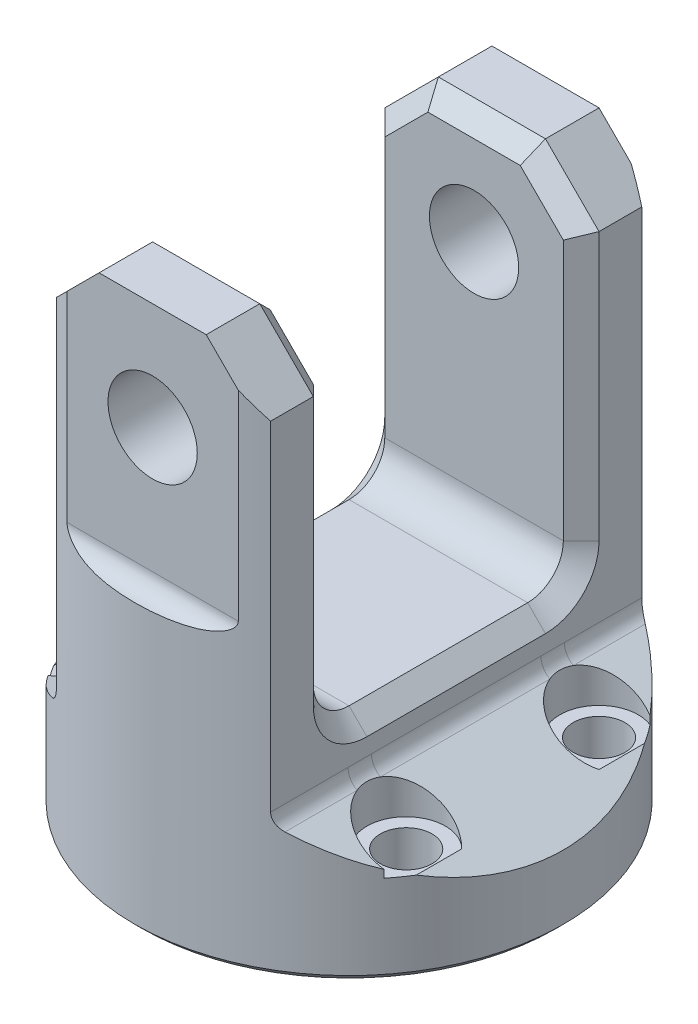
from build123d import *

# Parameters (mm, degrees)
SKETCH_1_R                    = 60
EXTRUDE_1_DEPTH               = 150
SKETCH_2_OUTSIDE_W            = 167.3
SKETCH_2_OUTSIDE_H            = 197.3
CUT_EXTRUDE_2_DEPTH           = 75
SKETCH_3_W                    = 5
SKETCH_3_H                    = 70
CUT_EXTRUDE_3_DEPTH           = 185.932420089
SKETCH_4_W                    = 70
SKETCH_4_H                    = 100
CUT_EXTRUDE_4_DEPTH           = 185.932420089
M27X2_0_1_D                   = 25
HOLE_WIZARD_M16_2_D           = 14.5
HOLE_WIZARD_M16_2_CBORE_D     = 22
HOLE_WIZARD_M16_2_CBORE_DEPTH = 12
CHAMFER_1_SIZE                = 15
FILLET_1_R                    = 10
CHAMFER_2_SIZE                = 5
FILLET_2_R                    = 5
FILLET_3_R                    = 5
CHAMFER_3_SIZE                = 2


# Some blends are built 0.0001 mm under size
with BuildPart() as part:
    # 草圖1 → 填料-伸長1 (new body)
    with BuildSketch(Plane(origin=(0, 0, 0), x_dir=(1, 0, 0), z_dir=(0, 1, 0))):
        with Locations(Location((0, 0, 0), (0, 0, 270))):
            Circle(SKETCH_1_R)
    extrude(amount=EXTRUDE_1_DEPTH)

    # 草圖2 outside → 除料-伸長2 (cut, symmetric)
    with BuildSketch(Plane.XY):
        with Locations((0, 75)):
            Rectangle(SKETCH_2_OUTSIDE_W, SKETCH_2_OUTSIDE_H)
        Polygon((-30, 150), (30, 150), (30, 37.320508076), (60, 20), (60, 0), (-60, 0), (-60, 20), (-30, 37.320508076), align=None, mode=Mode.SUBTRACT)
    extrude(amount=CUT_EXTRUDE_2_DEPTH, both=True, mode=Mode.SUBTRACT)

    # 草圖3 → 除料-伸長3 (cut, through all)
    with BuildSketch(Plane.ZY.offset(30)):
        with Locations((57.5, 115)):
            Rectangle(SKETCH_3_W, SKETCH_3_H)
        with Locations((-57.5, 115)):
            Rectangle(SKETCH_3_W, SKETCH_3_H)
    extrude(amount=-CUT_EXTRUDE_3_DEPTH, mode=Mode.SUBTRACT)

    # 草圖4 → 除料-伸長4 (cut, through all)
    with BuildSketch(Plane(origin=(30, 0, 0), x_dir=(0, 0, -1), z_dir=(1, 0, 0))):
        with Locations((0, 100)):
            Rectangle(SKETCH_4_W, SKETCH_4_H)
    extrude(amount=-CUT_EXTRUDE_4_DEPTH, mode=Mode.SUBTRACT)

    # M27x2.0 螺紋孔1 (through all)
    with Locations(Plane.XY.offset(55)):
        with Locations((0, 120)):
            Hole(M27X2_0_1_D / 2)

    # M16 六角頭螺栓的柱孔2 (through all)
    with Locations(Plane(origin=(0, 37.320508076, 0), x_dir=(1, 0, 0), z_dir=(0, 1, 0))):
        with Locations((43, -27), (43, 27), (-43, 27), (-43, -27)):
            CounterBoreHole(HOLE_WIZARD_M16_2_D / 2, HOLE_WIZARD_M16_2_CBORE_D / 2, HOLE_WIZARD_M16_2_CBORE_DEPTH)

    # 導角1
    # the kernel refuses this chamfer: 15 mm, written as the material it takes off along each edge
    with BuildSketch(Plane(origin=(30, 150, -3.575244819), x_dir=(0.0274958766105861, -0.9996219169112968, 0), z_dir=(0, 0, 1)), Plane(origin=(-30, 150, 90.536769047), x_dir=(-0.0274958766105861, -0.9996219169112968, 0), z_dir=(0, 0, -1)), Plane(origin=(30, 150, -90.536769047), x_dir=(0.0274958766105861, -0.9996219169112968, 0), z_dir=(0, 0, 1))) as chamfer_1_piece_1:
        Polygon((CHAMFER_1_SIZE * 0.999621916911, -CHAMFER_1_SIZE * 0.0274958766106), (-CHAMFER_1_SIZE * 0.0274958766106, -CHAMFER_1_SIZE * 0.999621916911), (0, 0), align=None)
    extrude(amount=94.112013866, mode=Mode.SUBTRACT)
    with BuildSketch(Plane(origin=(-30, 150, 3.575244819), x_dir=(0.9996219169112968, 0.02749587661058586, 0), z_dir=(0, 0, -1))) as chamfer_1_piece_2:
        Polygon((CHAMFER_1_SIZE * 0.999621916911, CHAMFER_1_SIZE * 0.0274958766106), (-CHAMFER_1_SIZE * 0.0274958766106, CHAMFER_1_SIZE * 0.999621916911), (0, 0), align=None)
    extrude(amount=94.112013866, mode=Mode.SUBTRACT)

    # 圓角1
    fillet_1_edges = [part.edges().sort_by_distance(p)[0] for p in [
        (0, 50, 35),
        (0, 50, -35),
    ]]
    fillet(fillet_1_edges, radius=FILLET_1_R)

    # 導角2
    chamfer_2_edges = [part.edges().sort_by_distance(p)[0] for p in [
        (0, 150, 35),
        (30, 97.5, 35),
        (-22.5, 142.5, 35),
        (22.5, 142.5, 35),
        (-30, 97.5, -35),
        (0, 150, -35),
        (22.5, 142.5, -35),
        (-22.5, 142.5, -35),
        (-30, 50, 0),
        (30, 50, 0),
        (-30, 97.5, 35),
        (30, 97.5, -35),
        (30, 52.928932188, 32.071067812),
        (-30, 52.928932188, 32.071067812),
        (30, 52.928932188, -32.071067812),
        (-30, 52.928932188, -32.071067812),
    ]]
    chamfer(chamfer_2_edges, length=CHAMFER_2_SIZE)

    # 圓角2
    fillet_2_edges = [part.edges().sort_by_distance(p)[0] for p in [
        (0, 80, 55),
        (0, 80, -55),
    ]]
    fillet(fillet_2_edges, radius=FILLET_2_R - 0.0001)  # a hair under: the kernel refuses the full size

    # 圓角3
    fillet_3_edges = [part.edges().sort_by_distance(p)[0] for p in [
        (30, 37.320508076, 0),
        (-30, 37.320508076, 0),
    ]]
    fillet(fillet_3_edges, radius=FILLET_3_R)

    # 導角3
    # the kernel refuses this chamfer: 2 mm, written as the material it takes off along each edge
    with BuildSketch(Plane(origin=(0, 0, 0), x_dir=(0, 0, 1), z_dir=(-1, 0, 0))) as chamfer_3_piece_1:
        Polygon((60, CHAMFER_3_SIZE), (60 - CHAMFER_3_SIZE, 0), (60, 0), align=None)
    revolve(axis=Axis((0, 0, 0), (0, 1, 0)), mode=Mode.SUBTRACT)


solid = part.part
